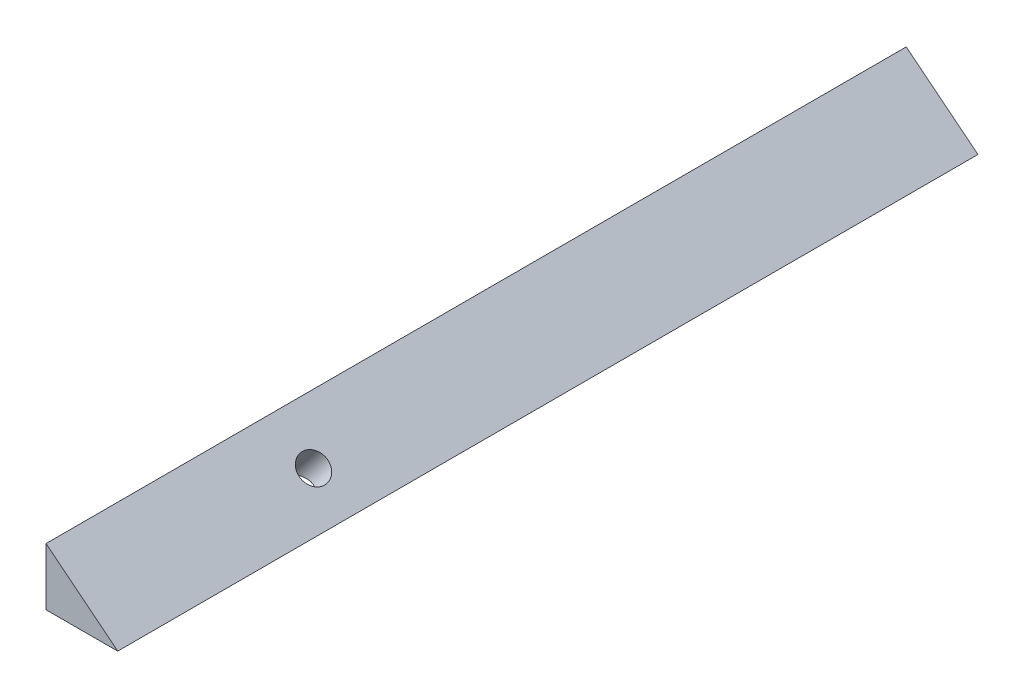
from build123d import *

# Parameters (mm, degrees)
BOSS_EXTRUDE1_DEPTH = 38.1
BOSS_EXTRUDE2_DEPTH = 292.1
BOSS_EXTRUDE3_DEPTH = 431.8
SKETCH6_R           = 12.7
CUT_EXTRUDE2_DEPTH  = 431.8


with BuildPart() as part:
    # Sketch1 → Boss-Extrude1 (new body)
    with BuildSketch(Plane.XY):
        Polygon((0, 0), (63.5, 0), (0, 50.8), align=None)
    extrude(amount=-BOSS_EXTRUDE1_DEPTH)

    # Sketch3 → Boss-Extrude2 (add)
    with BuildSketch(Plane.XY):
        Polygon((0, 50.8), (0, 0), (63.5, 0), align=None)
    extrude(amount=BOSS_EXTRUDE2_DEPTH)

    # Sketch4 → Boss-Extrude3 (add)
    with BuildSketch(Plane(origin=(0, 0, -38.1), x_dir=(-1, 0, 0), z_dir=(0, 0, -1))):
        Polygon((0, 50.8), (-63.5, 0), (0, 0), align=None)
    extrude(amount=BOSS_EXTRUDE3_DEPTH)

    # Sketch6 → Cut-Extrude2 (cut)
    with BuildSketch(Plane(origin=(24.780487805, 30.975609756, 0), x_dir=(0.7808688094430303, -0.6246950475544244, 0), z_dir=(0.6246950475544244, 0.7808688094430304, 0))):
        with Locations((11.4851694, -88.9)):
            Circle(SKETCH6_R)
    extrude(amount=-CUT_EXTRUDE2_DEPTH, mode=Mode.SUBTRACT)


solid = part.part
